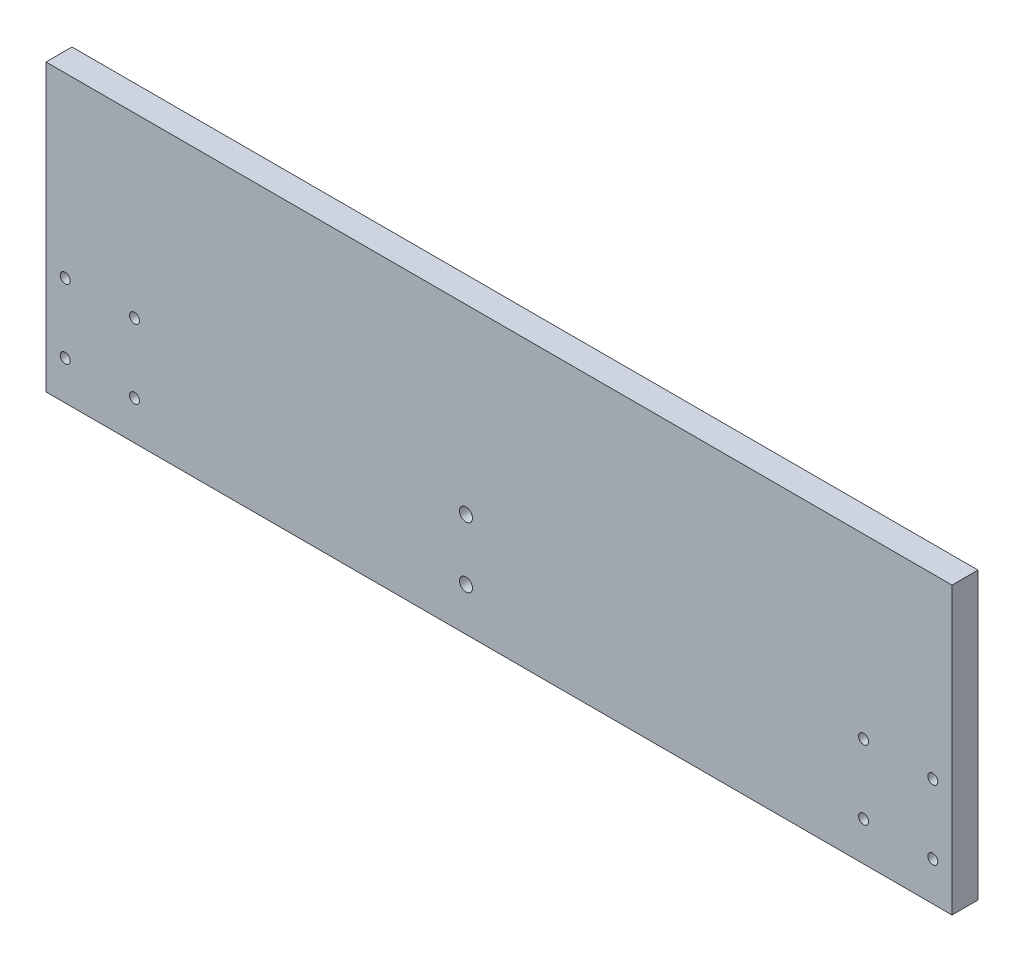
from build123d import *

# Parameters (mm, degrees)
BOSS_EXTRU_1_DEPTH      = 6
ESQUISSE2_R             = 1.15
ESQUISSE2_R_2           = 1.5
ENL_V_MAT_EXTRU_1_DEPTH = 6


with BuildPart() as part:
    # Esquisse1 → Boss.-Extru.1 (new body)
    with BuildSketch(Plane.XY):
        Polygon((-104.63, 17), (-104.63, -17), (104.63, -17), (104.63, 17), (104.63, 49), (-104.63, 49), align=None)
    extrude(amount=BOSS_EXTRU_1_DEPTH)

    # Esquisse2 → Enlèv. mat.-Extru.1 (cut)
    with BuildSketch(Plane.XY.offset(6)):
        with Locations((-100.2, 8)):
            Circle(ESQUISSE2_R)
        with Locations((-84.2, 8)):
            Circle(ESQUISSE2_R)
        with Locations((-84.2, -8)):
            Circle(ESQUISSE2_R)
        with Locations((-100.2, -8)):
            Circle(ESQUISSE2_R)
        with Locations((100.2, -8)):
            Circle(ESQUISSE2_R)
        with Locations((84.2, -8)):
            Circle(ESQUISSE2_R)
        with Locations((84.2, 8)):
            Circle(ESQUISSE2_R)
        with Locations((100.2, 8)):
            Circle(ESQUISSE2_R)
        with Locations((-7.625, 7)):
            Circle(ESQUISSE2_R_2)
        with Locations((-7.625, -7)):
            Circle(ESQUISSE2_R_2)
    extrude(amount=-ENL_V_MAT_EXTRU_1_DEPTH, mode=Mode.SUBTRACT)


solid = part.part
